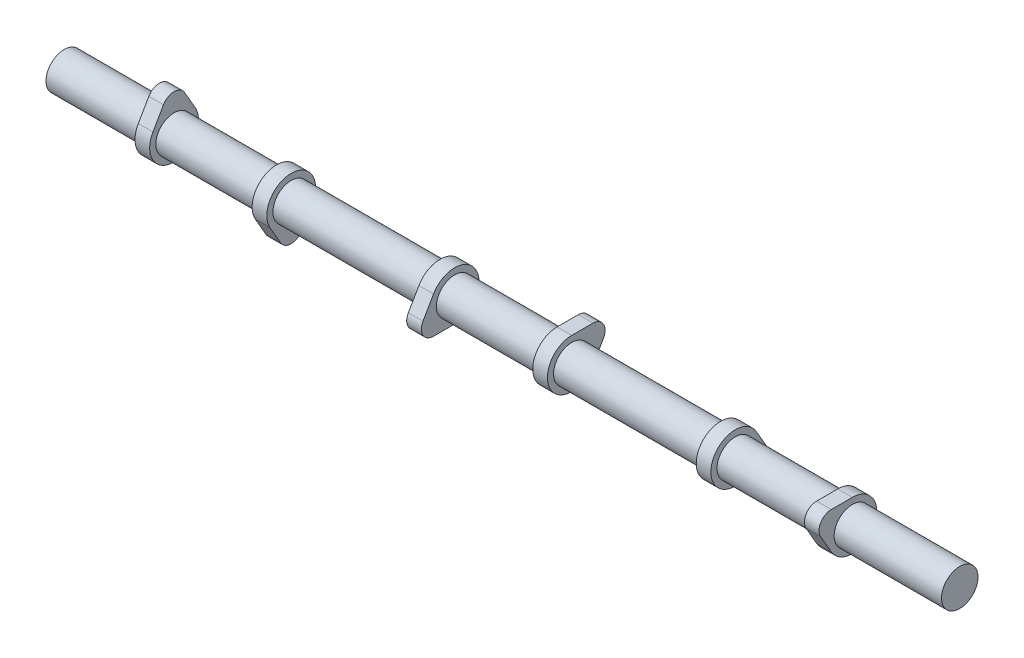
from build123d import *

# Parameters (mm, degrees)
BOSS_EXTRUDE1_DEPTH   = 3.81
BODY_MOVE_COPY2_ANGLE = 180
BOSS_EXTRUDE3_START   = -25.4
SKETCH2_R             = 9.5
BOSS_EXTRUDE3_DEPTH   = 146.05
LPATTERN1_COUNT       = 3
LPATTERN1_PITCH       = 146.05
BODY_MOVE_COPY3_ANGLE = 120
BODY_MOVE_COPY4_ANGLE = 120
BOSS_EXTRUDE4_START   = 27.94
SKETCH3_R             = 9.5
BOSS_EXTRUDE4_DEPTH   = 27.94


with BuildPart() as part:
    # Sketch1 → Boss-Extrude1 (new, symmetric)
    with BuildSketch(Plane(origin=(0, 0, 0), x_dir=(0, 0, -1), z_dir=(1, 0, 0))):
        with BuildLine():
            Line((-10.998522628, 6.35), (-5.499261314, 15.875))
            ThreePointArc((-5.499261314, 15.875), (0, 19.05), (5.499261314, 15.875))
            Line((5.499261314, 15.875), (10.998522628, 6.35))
            ThreePointArc((10.998522628, 6.35), (0, -12.7), (-10.998522628, 6.35))
        make_face()
    extrude(amount=BOSS_EXTRUDE1_DEPTH, both=True)


with BuildPart() as body_2:
    # Body-Move/Copy1: copy of part
    add(part.part.moved(Location((60.96, 0, 0))))


with BuildPart() as body_2_1:
    # Body-Move/Copy2: moved
    add(body_2.part.rotate(Axis((0, 0, 0), (1, 0, 0)), BODY_MOVE_COPY2_ANGLE))


with BuildPart() as part_1:
    add(part.part)

    add(body_2_1.part)  # Boss-Extrude3 merges body 2
    # Sketch2 → Boss-Extrude3 (add)
    with BuildSketch(Plane(origin=(0, 0, 0), x_dir=(0, 0, -1), z_dir=(1, 0, 0)).offset(BOSS_EXTRUDE3_START)):
        Circle(SKETCH2_R)
    extrude(amount=BOSS_EXTRUDE3_DEPTH)


with BuildPart() as lpattern1_1:
    # LPattern1: pattern copy
    add(part_1.part.moved(Location(Vector(1, 0, 0) * (1 * LPATTERN1_PITCH))))


with BuildPart() as lpattern1_2:
    # LPattern1: pattern copy
    add(part_1.part.moved(Location(Vector(1, 0, 0) * (2 * LPATTERN1_PITCH))))


with BuildPart() as lpattern1_1_1:
    # Body-Move/Copy3: moved
    add(lpattern1_1.part.rotate(Axis((0, 0, 0), (1, 0, 0)), BODY_MOVE_COPY3_ANGLE))


with BuildPart() as lpattern1_2_1:
    # Body-Move/Copy4: moved
    add(lpattern1_2.part.rotate(Axis((0, 0, 0), (-1, 0, 0)), BODY_MOVE_COPY4_ANGLE))


with BuildPart() as part_2:
    add(part_1.part)

    # Sketch3 → Boss-Extrude4 (add)
    with BuildSketch(Plane.ZY.offset(25.4).offset(BOSS_EXTRUDE4_START)):
        Circle(SKETCH3_R)
    extrude(amount=-BOSS_EXTRUDE4_DEPTH)


with BuildPart() as lpattern1_1_2:
    add(lpattern1_1_1.part)

    # Combine1: union part, LPattern1_2
    add(part_2.part)
    add(lpattern1_2_1.part)


solid = lpattern1_1_2.part
